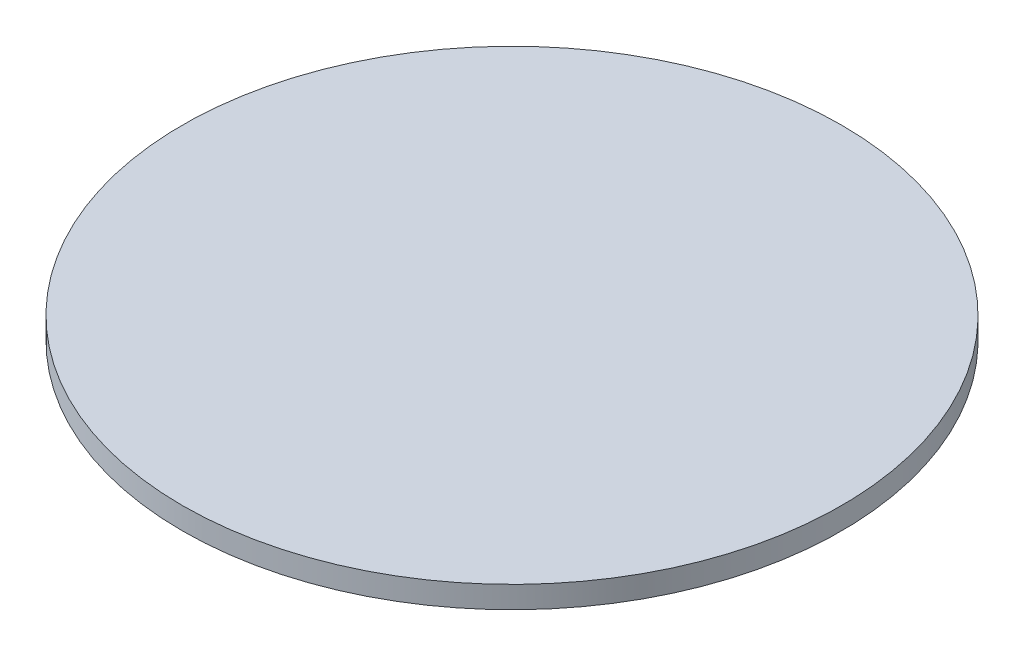
from build123d import *

# Parameters (mm, degrees)
SKIZZE1_R                         = 10
AUFSATZ_LINEAR_AUSTRAGEN1_DEPTH   = 2
SKIZZE2_R                         = 30
AUFSATZ_LINEAR_AUSTRAGEN2_DEPTH   = 2
AUFSATZ_LINEAR_AUSTRAGEN3_DEPTH   = 2
AUFSATZ_LINEAR_AUSTRAGEN3_2_DEPTH = 2
SKIZZE4_R                         = 10
AUFSATZ_LINEAR_AUSTRAGEN4_DEPTH   = 2
AUFSATZ_LINEAR_START              = 3
AUFSATZ_LINEAR_AUSTRAGEN15_DEPTH  = 3


with BuildPart() as part:
    # Skizze1 → Aufsatz-Linear austragen1 (new body)
    with BuildSketch(Plane(origin=(0, 0, 0), x_dir=(1, 0, 0), z_dir=(0, 1, 0))):
        Circle(SKIZZE1_R)
    extrude(amount=-AUFSATZ_LINEAR_AUSTRAGEN1_DEPTH)

    # Skizze2 → Aufsatz-Linear austragen2 (add)
    with BuildSketch(Plane(origin=(0, 0, 0), x_dir=(1, 0, 0), z_dir=(0, 1, 0))):
        Circle(SKIZZE2_R)
    extrude(amount=AUFSATZ_LINEAR_AUSTRAGEN2_DEPTH)



with BuildPart() as body_2:
    # Skizze3 → Aufsatz-Linear austragen3 (new body)
    with BuildSketch(Plane.XZ.offset(2)):
        with BuildLine():
            Line((-7.071067812, 7.071067812), (-9.192388155, 9.192388155))
            ThreePointArc((-9.192388155, 9.192388155), (-13, 0), (-9.192388155, -9.192388155))
            Line((-9.192388155, -9.192388155), (-7.071067812, -7.071067812))
            ThreePointArc((-7.071067812, -7.071067812), (-10, 0), (-7.071067812, 7.071067812))
        make_face()
    extrude(amount=AUFSATZ_LINEAR_AUSTRAGEN3_DEPTH)


with BuildPart() as body_3:
    # Skizze3 → Aufsatz-Linear austragen3 2 (new body)
    with BuildSketch(Plane.XZ.offset(2)):
        with BuildLine():
            Line((7.071067812, 7.071067812), (9.192388155, 9.192388155))
            ThreePointArc((9.192388155, 9.192388155), (13, 0), (9.192388155, -9.192388155))
            Line((9.192388155, -9.192388155), (7.071067812, -7.071067812))
            ThreePointArc((7.071067812, -7.071067812), (10, 0), (7.071067812, 7.071067812))
        make_face()
    extrude(amount=AUFSATZ_LINEAR_AUSTRAGEN3_2_DEPTH)


with BuildPart() as part_1:
    add(part.part)

    add(body_2.part)  # Aufsatz-Linear austragen4 merges body 2

    add(body_3.part)  # Aufsatz-Linear austragen4 merges body 3
    # Skizze4 → Aufsatz-Linear austragen4 (add)
    with BuildSketch(Plane.XZ.offset(2)):
        Circle(SKIZZE4_R)
    extrude(amount=AUFSATZ_LINEAR_AUSTRAGEN4_DEPTH)

    # Skizze8 → Aufsatz-Linear austragen15 (add)
    with BuildSketch(Plane(origin=(0, -2, 0), x_dir=(1, 0, 0), z_dir=(0, 1, 0)).offset(AUFSATZ_LINEAR_START)):
        with BuildLine():
            Line((10.076521944, -8.213629254), (7.737557516, -6.334840462))
            ThreePointArc((7.737557516, -6.334840462), (7.413457608, -6.711232845), (7.071067812, -7.071067812))
            Line((7.071067812, -7.071067812), (9.192388155, -9.192388155))
            ThreePointArc((9.192388155, -9.192388155), (9.646875989, -8.714228804), (10.076521944, -8.213629254))
        make_face()
        with BuildLine():
            Line((-7.071067812, 7.071067812), (-9.192388155, 9.192388155))
            ThreePointArc((-9.192388155, 9.192388155), (-9.636776415, 8.725396284), (-10.057468336, 8.236949111))
            Line((-10.057468336, 8.236949111), (-7.732766819, 6.340687449))
            ThreePointArc((-7.732766819, 6.340687449), (-7.410920578, 6.714034271), (-7.071067812, 7.071067812))
        make_face()
    extrude(amount=-AUFSATZ_LINEAR_AUSTRAGEN15_DEPTH)


solid = part_1.part
